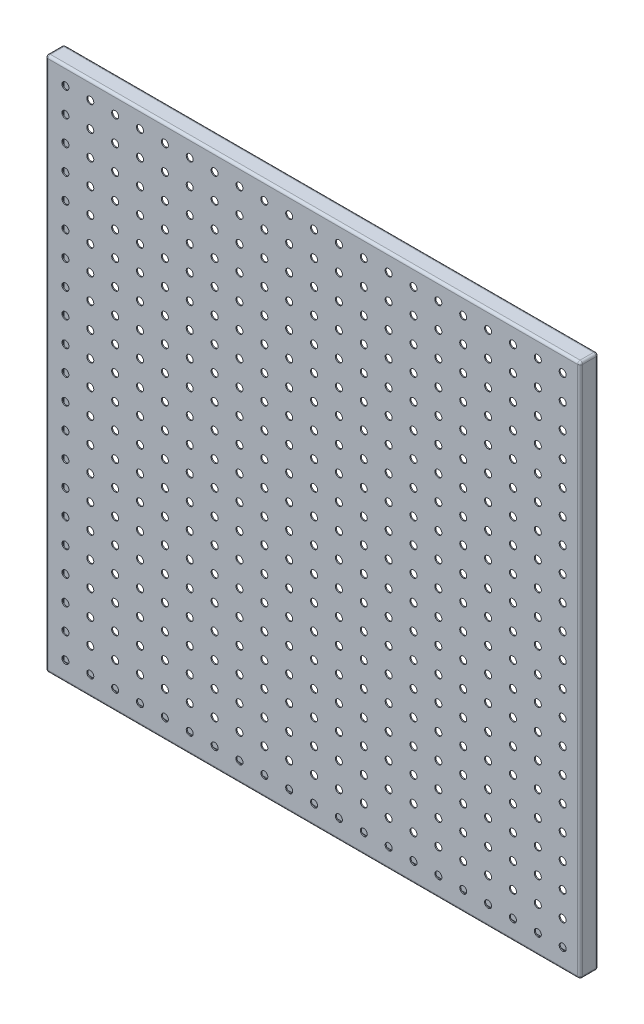
from build123d import *

# Parameters (mm, degrees)
SKETCH2_W            = 546.1
SKETCH2_H            = 546.1
BOSS_EXTRUDE1_DEPTH  = 1.016
SKETCH3_R            = 3.571875
CUT_EXTRUDE1_DEPTH   = 773.30269471
LPATTERN1_COUNT      = 11
LPATTERN1_PITCH      = 50.8
LPATTERN1_COUNT_DIR2 = 11
LPATTERN1_PITCH_DIR2 = 50.8
BOSS_EXTRUDE2_DEPTH  = 546.1
BOSS_EXTRUDE3_DEPTH  = 546.1
FILLET1_R            = 2.54


with BuildPart() as part:
    # Sketch2 → Boss-Extrude1 (new body)
    with BuildSketch(Plane.XY):
        with Locations((273.05, 273.05)):
            Rectangle(SKETCH2_W, SKETCH2_H)
    extrude(amount=BOSS_EXTRUDE1_DEPTH)

    # Sketch3 → Cut-Extrude1 (cut, through all)
    with BuildSketch(Plane.XY.offset(1.016)):
        with Locations((20.32, 20.32)):
            Circle(SKETCH3_R)
        with Locations((45.72, 20.32)):
            Circle(SKETCH3_R)
        with Locations((45.72, 45.72)):
            Circle(SKETCH3_R)
        with Locations((20.32, 45.72)):
            Circle(SKETCH3_R)
    cut_extrude1 = extrude(amount=-CUT_EXTRUDE1_DEPTH, mode=Mode.SUBTRACT)

    # LPattern1: Cut-Extrude1 11 × 11
    with Locations(*[(j * LPATTERN1_PITCH_DIR2, i * LPATTERN1_PITCH, 0) for i in range(LPATTERN1_COUNT) for j in range(LPATTERN1_COUNT_DIR2) if (i, j) != (0, 0)]):
        add(cut_extrude1, mode=Mode.SUBTRACT)

    # Sketch4 → Boss-Extrude2 (add)
    with BuildSketch(Plane(origin=(0, 546.1, 0), x_dir=(1, 0, 0), z_dir=(0, 1, 0))):
        Polygon((0, 0), (0, 17.78), (12.7, 17.78), (12.7, 16.764), (1.016, 16.764), (1.016, 0), align=None)
        Polygon((546.1, 0), (546.1, 17.78), (533.4, 17.78), (533.4, 16.764), (545.084, 16.764), (545.084, 0), align=None)
    extrude(amount=-BOSS_EXTRUDE2_DEPTH)

    # Sketch5 → Boss-Extrude3 (add)
    with BuildSketch(Plane(origin=(546.1, 0, 0), x_dir=(0, 0, -1), z_dir=(1, 0, 0))):
        Polygon((0, 546.1), (17.78, 546.1), (17.78, 533.4), (16.764, 533.4), (16.764, 545.084), (0, 545.084), align=None)
        Polygon((0, 0), (17.78, 0), (17.78, 12.7), (16.764, 12.7), (16.764, 1.016), (0, 1.016), align=None)
    extrude(amount=-BOSS_EXTRUDE3_DEPTH)

    # Fillet1
    fillet1_edges = [part.edges().sort_by_distance(p)[0] for p in [
        (546.1, 273.05, 1.016),
        (273.05, 0, -17.78),
        (0, 273.05, -17.78),
        (273.05, 546.1, -17.78),
        (546.1, 273.05, -17.78),
        (273.05, 546.1, 1.016),
        (0, 273.05, 1.016),
        (0, 546.1, -8.382),
        (546.1, 546.1, -8.382),
        (546.1, 0, -8.382),
        (0, 0, -8.382),
        (273.05, 0, 1.016),
    ]]
    fillet(fillet1_edges, radius=FILLET1_R)


solid = part.part
